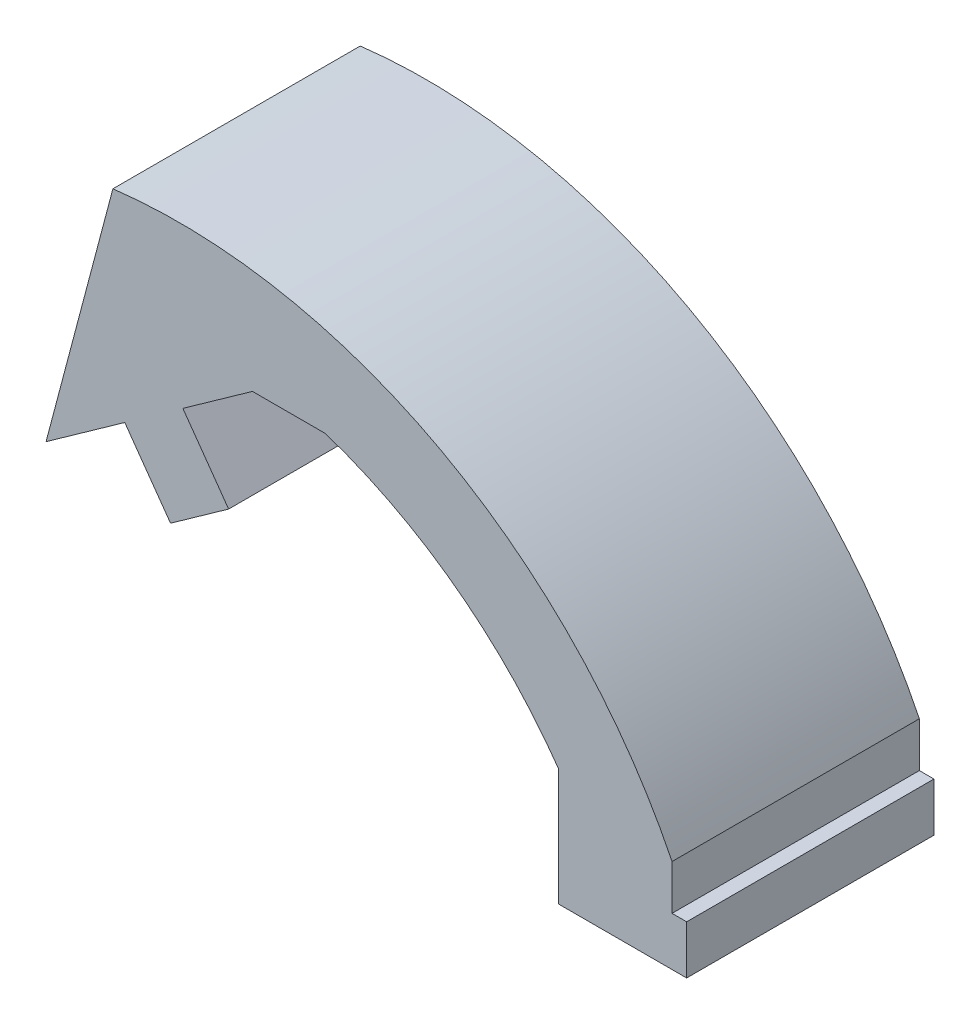
from build123d import *

# Parameters (mm, degrees)
BOSS_EXTRUDE1_DEPTH = 12.7


with BuildPart() as part:
    # Sketch4 → Boss-Extrude1 (new body)
    with BuildSketch(Plane.XY):
        with BuildLine():
            Line((-17.272249722, 0.35), (-17.272249722, 6.35))
            ThreePointArc((-17.272249722, 6.35), (-22.541008288, 11.785028601), (-29.250779761, 15.289071908))
            Line((-29.250779761, 15.289071908), (-33.000779761, 15.289071908))
            Line((-33.000779761, 15.289071908), (-36.574286085, 12.74836463))
            Line((-36.574286085, 12.74836463), (-34.224656355, 9.443608992))
            Line((-34.224656355, 9.443608992), (-37.207735231, 7.322686424))
            Line((-37.207735231, 7.322686424), (-39.557364961, 10.627442062))
            Line((-39.557364961, 10.627442062), (-43.600737386, 7.752667312))
            Line((-43.600737386, 7.752667312), (-40.167503005, 20.716654857))
            ThreePointArc((-40.167503005, 20.716654857), (-23.328429574, 17.515917652), (-11.45417462, 5.15464013))
            Line((-11.45417462, 5.15464013), (-11.45417462, 2.85))
            Line((-11.45417462, 2.85), (-10.70417462, 2.85))
            Line((-10.70417462, 2.85), (-10.70417462, 0.35))
            Line((-10.70417462, 0.35), (-11.412456608, 0.35))
            Line((-11.412456608, 0.35), (-17.272249722, 0.35))
        make_face()
    extrude(amount=-BOSS_EXTRUDE1_DEPTH)


solid = part.part
